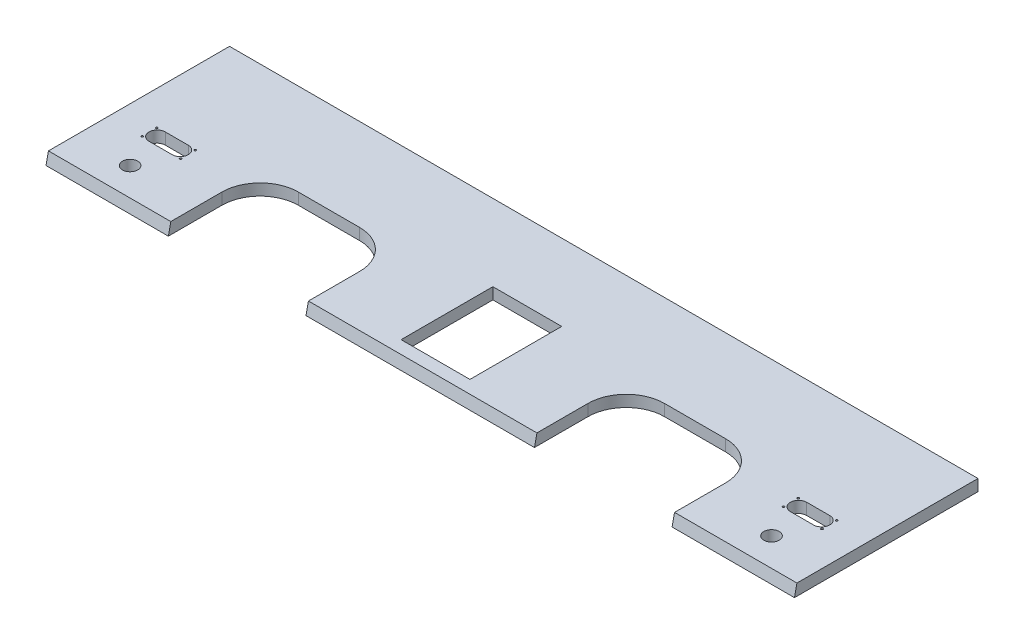
from build123d import *
from OCP.BRepFilletAPI import BRepFilletAPI_MakeChamfer

# Parameters (mm, degrees)
SKETCH1_W           = 1243.0125
SKETCH1_H           = 304.8
BOSS_EXTRUDE1_DEPTH = 19.05
CUT_EXTRUDE2_DEPTH  = 641.202062859
SKETCH5_W           = 114.3
SKETCH5_H           = 152.4
CUT_EXTRUDE3_DEPTH  = 641.202062859
SKETCH6_R           = 12.7
CUT_EXTRUDE4_DEPTH  = 641.202062859
CHAMFER1_SIZE       = 19.05
CHAMFER1_SIZE_2     = 4.0492025
SKETCH8_R           = 1.65
CUT_EXTRUDE5_DEPTH  = 641.202062859


with BuildPart() as part:
    # Sketch1 → Boss-Extrude1 (new body)
    with BuildSketch(Plane(origin=(0, 0, 0), x_dir=(1, 0, 0), z_dir=(0, 1, 0))):
        Rectangle(SKETCH1_W, SKETCH1_H)
    extrude(amount=BOSS_EXTRUDE1_DEPTH)

    # Sketch4 → Cut-Extrude2 (cut, through all)
    with BuildSketch(Plane(origin=(0, 19.05, 0), x_dir=(1, 0, 0), z_dir=(0, 1, 0))):
        with BuildLine():
            Line((-418.30625, -152.4), (-418.30625, -63.5))
            ThreePointArc((-418.30625, -63.5), (-399.707530605, -18.598719395), (-354.80625, 0))
            Line((-354.80625, 0), (-253.20625, 0))
            ThreePointArc((-253.20625, 0), (-208.304969395, -18.598719395), (-189.70625, -63.5))
            Line((-189.70625, -63.5), (-189.70625, -152.4))
            Line((-189.70625, -152.4), (-418.30625, -152.4))
        make_face()
        with BuildLine():
            Line((189.70625, -152.4), (189.70625, -63.5))
            ThreePointArc((189.70625, -63.5), (208.304969395, -18.598719395), (253.20625, 0))
            Line((253.20625, 0), (354.80625, 0))
            ThreePointArc((354.80625, 0), (399.707530605, -18.598719395), (418.30625, -63.5))
            Line((418.30625, -63.5), (418.30625, -152.4))
            Line((418.30625, -152.4), (189.70625, -152.4))
        make_face()
    extrude(amount=-CUT_EXTRUDE2_DEPTH, mode=Mode.SUBTRACT)

    # Sketch5 → Cut-Extrude3 (cut, through all)
    with BuildSketch(Plane(origin=(0, 19.05, 0), x_dir=(1, 0, 0), z_dir=(0, 1, 0))):
        with Locations((0, -50.8)):
            Rectangle(SKETCH5_W, SKETCH5_H)
    extrude(amount=-CUT_EXTRUDE3_DEPTH, mode=Mode.SUBTRACT)

    # Sketch6 → Cut-Extrude4 (cut, through all)
    with BuildSketch(Plane(origin=(0, 19.05, 0), x_dir=(1, 0, 0), z_dir=(0, 1, 0))):
        with Locations(Location((-532.60625, -101.6, 0), (0, 0, 270))):
            Circle(SKETCH6_R)
        with Locations(Location((532.60625, -101.6, 0), (0, 0, 270))):
            Circle(SKETCH6_R)
    extrude(amount=-CUT_EXTRUDE4_DEPTH, mode=Mode.SUBTRACT)

    # Chamfer1
    chamfer1_edges_1 = [part.edges().sort_by_distance(p)[0] for p in [
        (519.90625, 19.05, 152.4),
    ]]
    chamfer1_side_1 = [part.faces().sort_by_distance(p)[0] for p in [
        (519.90625, 18.96901595, 152.4),
    ]]
    chamfer1_edges_2 = [part.edges().sort_by_distance(p)[0] for p in [
        (0, 19.05, 152.4),
    ]]
    chamfer1_side_2 = [part.faces().sort_by_distance(p)[0] for p in [
        (0, 19.05, 152.31901595),
    ]]
    chamfer1_edges_3 = [part.edges().sort_by_distance(p)[0] for p in [
        (-519.90625, 19.05, 152.4),
    ]]
    chamfer1_side_3 = [part.faces().sort_by_distance(p)[0] for p in [
        (-519.90625, 19.05, 152.31901595),
    ]]
    chamfer1 = BRepFilletAPI_MakeChamfer(part.part.solid().wrapped)
    for e in chamfer1_edges_1:
        chamfer1.Add(CHAMFER1_SIZE - 0.0001, CHAMFER1_SIZE_2 - 0.0001, e.wrapped, chamfer1_side_1[0].wrapped)
    for e in chamfer1_edges_2:
        chamfer1.Add(CHAMFER1_SIZE_2 - 0.0001, CHAMFER1_SIZE - 0.0001, e.wrapped, chamfer1_side_2[0].wrapped)
    for e in chamfer1_edges_3:
        chamfer1.Add(CHAMFER1_SIZE_2 - 0.0001, CHAMFER1_SIZE - 0.0001, e.wrapped, chamfer1_side_3[0].wrapped)
    add(Compound.cast(chamfer1.Shape()), mode=Mode.REPLACE)  # a hair under: the kernel refuses the full size

    # Sketch8 → Cut-Extrude5 (cut, through all)
    with BuildSketch(Plane(origin=(0, 19.05, 0), x_dir=(1, 0, 0), z_dir=(0, 1, 0))):
        with Locations(Location((-564.50625, -25.4, 0), (0, 0, 270))):
            Circle(SKETCH8_R)
        with Locations(Location((-564.50625, -49.7, 0), (0, 0, 270))):
            Circle(SKETCH8_R)
        with Locations(Location((-500.70625, -49.7, 0), (0, 0, 270))):
            Circle(SKETCH8_R)
        with Locations(Location((-500.70625, -25.4, 0), (0, 0, 270))):
            Circle(SKETCH8_R)
        with Locations(Location((500.70625, -25.4, 0), (0, 0, 270))):
            Circle(SKETCH8_R)
        with Locations(Location((500.70625, -49.7, 0), (0, 0, 270))):
            Circle(SKETCH8_R)
        with Locations(Location((564.50625, -49.7, 0), (0, 0, 270))):
            Circle(SKETCH8_R)
        with Locations(Location((564.50625, -25.4, 0), (0, 0, 270))):
            Circle(SKETCH8_R)
        with BuildLine():
            Line((-513.40625, -51.05), (-551.80625, -51.05))
            ThreePointArc((-551.80625, -51.05), (-565.30625, -37.55), (-551.80625, -24.05))
            Line((-551.80625, -24.05), (-513.40625, -24.05))
            ThreePointArc((-513.40625, -24.05), (-499.90625, -37.55), (-513.40625, -51.05))
        make_face()
        with BuildLine():
            Line((513.40625, -51.05), (551.80625, -51.05))
            ThreePointArc((551.80625, -51.05), (565.30625, -37.55), (551.80625, -24.05))
            Line((551.80625, -24.05), (513.40625, -24.05))
            ThreePointArc((513.40625, -24.05), (499.90625, -37.55), (513.40625, -51.05))
        make_face()
    extrude(amount=-CUT_EXTRUDE5_DEPTH, mode=Mode.SUBTRACT)


solid = part.part
